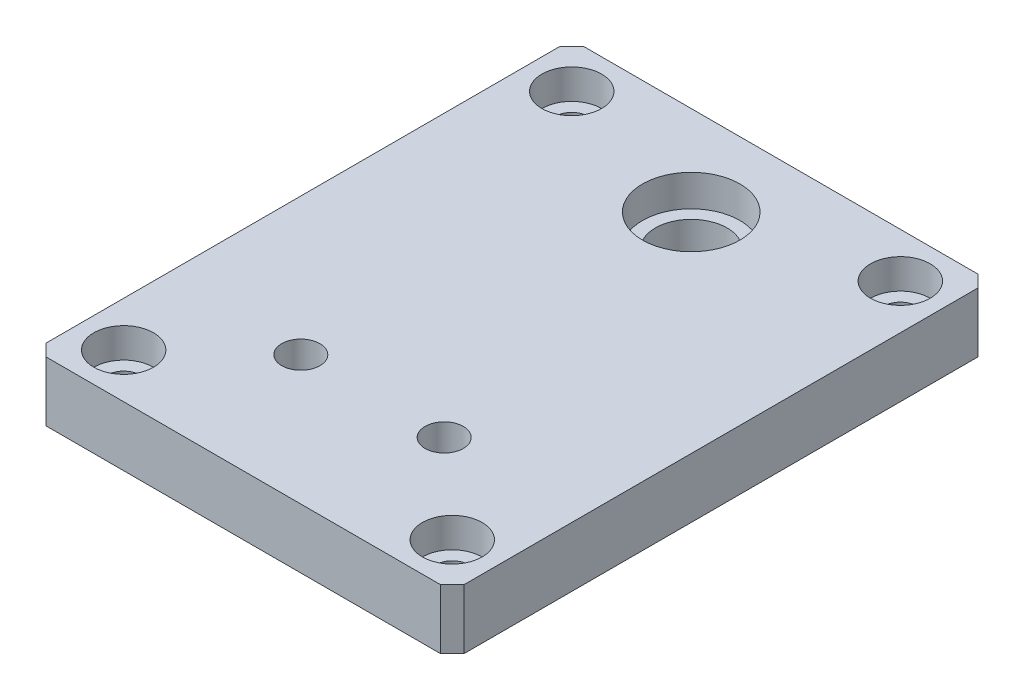
from build123d import *

# Parameters (mm, degrees)
SKETCH1_W                      = 70
SKETCH1_H                      = 90
BOSS_EXTRUDE1_DEPTH            = 10
CBORE_FOR_M5_SHCS1_D           = 5.5
CBORE_FOR_M5_SHCS1_CBORE_D     = 10
CBORE_FOR_M5_SHCS1_CBORE_DEPTH = 5
F_1_0MM_DOWEL_HOLE1_D          = 16.3
F_1_0MM_DOWEL_HOLE1_DEPTH      = 5.3
F_1_0MM_DOWEL_HOLE3_D          = 12
SKETCH14_R                     = 3.2
CUT_EXTRUDE1_DEPTH             = 58.879184514
CHAMFER1_SIZE                  = 2


with BuildPart() as part:
    # Sketch1 → Boss-Extrude1 (new body)
    with BuildSketch(Plane(origin=(0, 0, 0), x_dir=(1, 0, 0), z_dir=(0, 1, 0))):
        Rectangle(SKETCH1_W, SKETCH1_H)
    extrude(amount=BOSS_EXTRUDE1_DEPTH)

    # CBORE for M5 SHCS1 (through all)
    with Locations(Plane(origin=(0, 10, 0), x_dir=(1, 0, 0), z_dir=(0, 1, 0))):
        with Locations((-27.5, -37.5), (-27.5, 37.5), (27.5, 37.5), (27.5, -37.5)):
            CounterBoreHole(CBORE_FOR_M5_SHCS1_D / 2, CBORE_FOR_M5_SHCS1_CBORE_D / 2, CBORE_FOR_M5_SHCS1_CBORE_DEPTH)

    # Ø1.0mm Dowel Hole1
    with Locations(Plane(origin=(0, 10, 0), x_dir=(1, 0, 0), z_dir=(0, 1, 0))):
        with Locations((0, 30)):
            Hole(F_1_0MM_DOWEL_HOLE1_D / 2, depth=F_1_0MM_DOWEL_HOLE1_DEPTH)

    # Ø1.0mm Dowel Hole3 (through all)
    with Locations(Plane(origin=(0, 4.7, 0), x_dir=(1, 0, 0), z_dir=(0, 1, 0))):
        with Locations((0, 30)):
            Hole(F_1_0MM_DOWEL_HOLE3_D / 2)

    # Sketch14 → Cut-Extrude1 (cut, through all)
    with BuildSketch(Plane(origin=(0, 10, 0), x_dir=(1, 0, 0), z_dir=(0, 1, 0))):
        with Locations((12, -23.35)):
            Circle(SKETCH14_R)
        with Locations((-12, -23.35)):
            Circle(SKETCH14_R)
    extrude(amount=-CUT_EXTRUDE1_DEPTH, mode=Mode.SUBTRACT)

    # Chamfer1
    chamfer1_edges = [part.edges().sort_by_distance(p)[0] for p in [
        (35, 5, 45),
        (35, 5, -45),
        (-35, 5, -45),
        (-35, 5, 45),
    ]]
    chamfer(chamfer1_edges, length=CHAMFER1_SIZE)


solid = part.part
